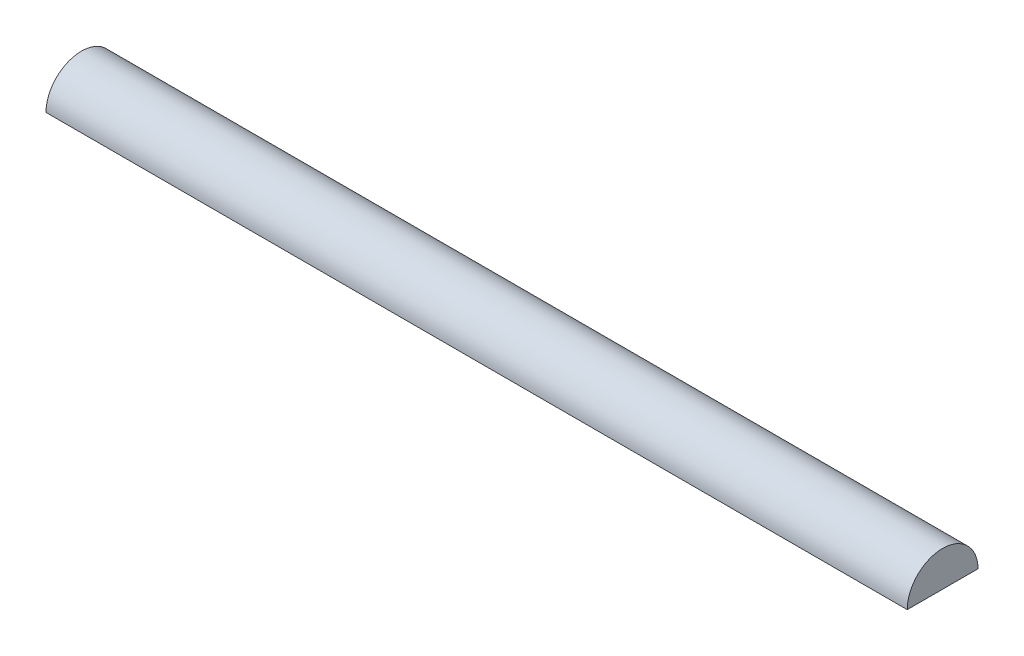
from build123d import *

# Parameters (mm, degrees)
BOSS_EXTRUDE1_DEPTH      = 10000
BOSS_EXTRUDE1_DEPTH_BACK = 20000
SKETCH2_R                = 1232.857562003
SKETCH3_W                = 30000
SKETCH3_H                = 3639.943339499
CUT_EXTRUDE1_DEPTH       = 20076.853046294


with BuildPart() as part:
    # Sketch1 → Revolve1 (revolve)
    with BuildSketch(Plane(origin=(0, 0, 0), x_dir=(-1, 0, 0), z_dir=(0, 1, 0))):
        Polygon((3855.701578498, 1120), (1793.384680535, 337.92), (3247.519684342, 368.69), (3247.519684342, 0), (8763.003370024, 0), (8763.003370024, 1070), (9793.384680535, 1070), (9493.387900456, 1120), align=None)
    revolve(axis=Axis((-3247.519684342, 0, 0), (-1, 0, 0)))


with BuildPart() as body_2:
    # Sketch2 → Boss-Extrude1 (new, two sides: drawn at the far end of the back side and taken through both)
    with BuildSketch(Plane(origin=(0, 0, 0), x_dir=(0, 0, -1), z_dir=(1, 0, 0)).offset(-BOSS_EXTRUDE1_DEPTH_BACK)):
        Circle(SKETCH2_R)
    extrude(amount=BOSS_EXTRUDE1_DEPTH + BOSS_EXTRUDE1_DEPTH_BACK)

    # Combine1: cut part
    add(part.part, mode=Mode.SUBTRACT)

    # Sketch3 → Cut-Extrude1 (cut, through all)
    with BuildSketch(Plane(origin=(0, 0, 0), x_dir=(-1, 0, 0), z_dir=(0, 1, 0))):
        with Locations((5000, 260.380744392)):
            Rectangle(SKETCH3_W, SKETCH3_H)
    extrude(amount=-CUT_EXTRUDE1_DEPTH, mode=Mode.SUBTRACT)


solid = body_2.part
